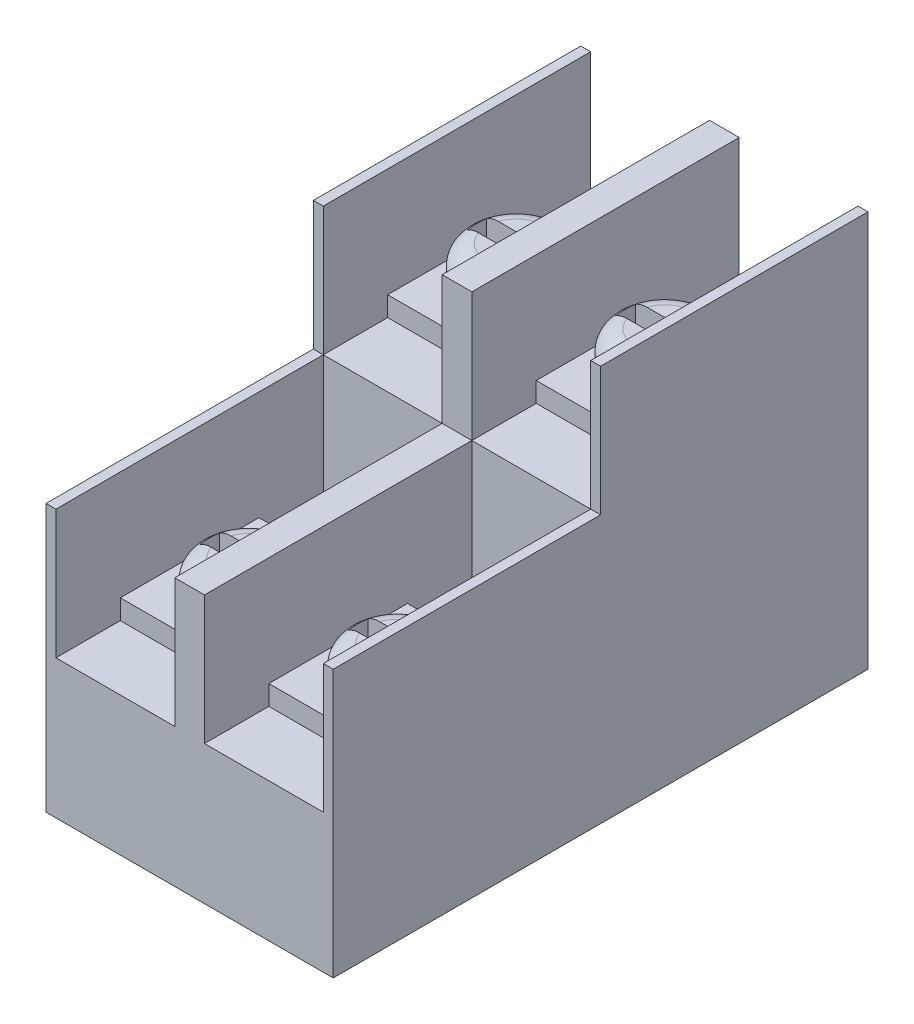
from build123d import *

# Parameters (mm, degrees)
SKETCH_2_W           = 14.5
SKETCH_2_H           = 27
EXTRUDE_1_DEPTH      = 20
SKETCH_3_W           = 13.5
SKETCH_3_H           = 6.5
CUT_EXTRUDE_1_DEPTH  = 29.151376521
SKETCH_5_W           = 6
SKETCH_5_H           = 13.5
CUT_EXTRUDE_2_DEPTH  = 6.5
SKETCH_7_W           = 6
SKETCH_7_H           = 13.5
CUT_EXTRUDE_4_DEPTH  = 6.5
SKETCH_8_W           = 6
SKETCH_8_H           = 7
SKETCH_8_R           = 1.75
EXTRUDE_3_DEPTH      = 1
SKETCH_9_W           = 6
SKETCH_9_H           = 7
SKETCH_9_R           = 1.75
EXTRUDE_4_DEPTH      = 1
SKETCH_10_R          = 2.5
EXTRUDE_5_DEPTH      = 2
SKETCH_14_R          = 2.5
EXTRUDE_6_DEPTH      = 1.5
FILLET_1_R           = 1
CUT_EXTRUDE_START    = -1.2
CUT_EXTRUDE_12_DEPTH = 1.2
CUT_EXTRUDE_13_DEPTH = 1.2
SKETCH_17_R          = 0.5
EXTRUDE_7_DEPTH      = 3


with BuildPart() as part:
    # 草图2 → 凸台-拉伸1 (new body)
    with BuildSketch(Plane(origin=(0, 0, 0), x_dir=(1, 0, 0), z_dir=(0, 1, 0))):
        Rectangle(SKETCH_2_W, SKETCH_2_H)
    extrude(amount=EXTRUDE_1_DEPTH)

    # 草图3 → 切除-拉伸1 (cut, through all)
    with BuildSketch(Plane(origin=(7.25, 0, 0), x_dir=(0, 0, -1), z_dir=(1, 0, 0))):
        with Locations((-6.75, 16.75)):
            Rectangle(SKETCH_3_W, SKETCH_3_H)
    extrude(amount=-CUT_EXTRUDE_1_DEPTH, mode=Mode.SUBTRACT)

    # 草图5 → 切除-拉伸2 (cut)
    with BuildSketch(Plane(origin=(0, 20, 0), x_dir=(1, 0, 0), z_dir=(0, 1, 0))):
        with Locations((3.75, 6.75)):
            Rectangle(SKETCH_5_W, SKETCH_5_H)
        with Locations((-3.75, 6.75)):
            Rectangle(SKETCH_5_W, SKETCH_5_H)
    extrude(amount=-CUT_EXTRUDE_2_DEPTH, mode=Mode.SUBTRACT)

    # 草图7 → 切除-拉伸4 (cut)
    with BuildSketch(Plane(origin=(0, 13.5, 0), x_dir=(1, 0, 0), z_dir=(0, 1, 0))):
        with Locations((3.75, -6.75)):
            Rectangle(SKETCH_7_W, SKETCH_7_H)
        with Locations((-3.75, -6.75)):
            Rectangle(SKETCH_7_W, SKETCH_7_H)
    extrude(amount=-CUT_EXTRUDE_4_DEPTH, mode=Mode.SUBTRACT)

    # 草图8 → 凸台-拉伸3 (add)
    # profile 1 of 2: a face of its own
    with BuildSketch(Plane(origin=(0, 13.5, 0), x_dir=(1, 0, 0), z_dir=(0, 1, 0))):
        with Locations((-3.75, 6.75)):
            Rectangle(SKETCH_8_W, SKETCH_8_H)
        with Locations((-3.75, 6.75)):
            Circle(SKETCH_8_R, mode=Mode.SUBTRACT)
    # profile 2 of 2: a face of its own
    with BuildSketch(Plane(origin=(0, 13.5, 0), x_dir=(1, 0, 0), z_dir=(0, 1, 0))):
        with Locations((3.75, 6.75)):
            Rectangle(SKETCH_8_W, SKETCH_8_H)
        with Locations((3.75, 6.75)):
            Circle(SKETCH_8_R, mode=Mode.SUBTRACT)
    extrude(amount=EXTRUDE_3_DEPTH)

    # 草图9 → 凸台-拉伸4 (add)
    # profile 1 of 2: a face of its own
    with BuildSketch(Plane(origin=(0, 7, 0), x_dir=(1, 0, 0), z_dir=(0, 1, 0))):
        with Locations((-3.75, -6.75)):
            Rectangle(SKETCH_9_W, SKETCH_9_H)
        with Locations((-3.75, -6.75)):
            Circle(SKETCH_9_R, mode=Mode.SUBTRACT)
    # profile 2 of 2: a face of its own
    with BuildSketch(Plane(origin=(0, 7, 0), x_dir=(1, 0, 0), z_dir=(0, 1, 0))):
        with Locations((3.75, -6.75)):
            Rectangle(SKETCH_9_W, SKETCH_9_H)
        with Locations((3.75, -6.75)):
            Circle(SKETCH_9_R, mode=Mode.SUBTRACT)
    extrude(amount=EXTRUDE_4_DEPTH)

    # 草图10 → 凸台-拉伸5 (add)
    with BuildSketch(Plane(origin=(0, 14.5, 0), x_dir=(1, 0, 0), z_dir=(0, 1, 0))):
        with Locations((3.75, 6.75)):
            Circle(SKETCH_10_R)
        with Locations((-3.75, 6.75)):
            Circle(SKETCH_10_R)
    extrude(amount=EXTRUDE_5_DEPTH)

    # 草图14 → 凸台-拉伸6 (add)
    with BuildSketch(Plane(origin=(0, 8, 0), x_dir=(1, 0, 0), z_dir=(0, 1, 0))):
        with Locations((-3.75, -6.75)):
            Circle(SKETCH_14_R)
        with Locations((3.75, -6.75)):
            Circle(SKETCH_14_R)
    extrude(amount=EXTRUDE_6_DEPTH)

    # 圆角1
    fillet_1_edges = [part.edges().sort_by_distance(p)[0] for p in [
        (-6.25, 16.5, -6.75),
        (1.25, 16.5, -6.75),
        (1.25, 9.5, 6.75),
        (-6.25, 9.5, 6.75),
    ]]
    fillet(fillet_1_edges, radius=FILLET_1_R)

    # 草图15 → 切除-拉伸12 (cut)
    with BuildSketch(Plane(origin=(0, 9.5, 0), x_dir=(1, 0, 0), z_dir=(0, 1, 0)).offset(CUT_EXTRUDE_START)):
        with BuildLine():
            Line((3.25, -9.199489743), (3.25, -7.25))
            Line((3.25, -7.25), (1.75, -7.25))
            Line((1.75, -7.25), (1.75, -6.25))
            Line((1.75, -6.25), (3.25, -6.25))
            Line((3.25, -6.25), (3.25, -4.300510257))
            ThreePointArc((3.25, -4.300510257), (3.75, -4.25), (4.25, -4.300510257))
            Line((4.25, -4.300510257), (4.25, -6.25))
            Line((4.25, -6.25), (5.75, -6.25))
            Line((5.75, -6.25), (5.75, -7.25))
            Line((5.75, -7.25), (4.25, -7.25))
            Line((4.25, -7.25), (4.25, -9.199489743))
            ThreePointArc((4.25, -9.199489743), (3.75, -9.25), (3.25, -9.199489743))
        make_face()
        with BuildLine():
            Line((-4.25, -6.25), (-5.75, -6.25))
            Line((-5.75, -6.25), (-5.75, -7.25))
            Line((-5.75, -7.25), (-4.25, -7.25))
            Line((-4.25, -7.25), (-4.25, -9.199489743))
            ThreePointArc((-4.25, -9.199489743), (-3.75, -9.25), (-3.25, -9.199489743))
            Line((-3.25, -9.199489743), (-3.25, -7.25))
            Line((-3.25, -7.25), (-1.75, -7.25))
            Line((-1.75, -7.25), (-1.75, -6.25))
            Line((-1.75, -6.25), (-3.25, -6.25))
            Line((-3.25, -6.25), (-3.25, -4.300510257))
            ThreePointArc((-3.25, -4.300510257), (-3.75, -4.25), (-4.25, -4.300510257))
            Line((-4.25, -4.300510257), (-4.25, -6.25))
        make_face()
    extrude(amount=CUT_EXTRUDE_12_DEPTH, mode=Mode.SUBTRACT)

    # 草图16 → 切除-拉伸13 (cut)
    with BuildSketch(Plane(origin=(0, 16.5, 0), x_dir=(1, 0, 0), z_dir=(0, 1, 0)).offset(CUT_EXTRUDE_START)):
        with BuildLine():
            Line((-3.25, 7.25), (-1.75, 7.25))
            Line((-1.75, 7.25), (-1.75, 6.25))
            Line((-1.75, 6.25), (-3.25, 6.25))
            Line((-3.25, 6.25), (-3.25, 4.280241369))
            ThreePointArc((-3.25, 4.280241369), (-3.75, 4.230137366), (-4.25, 4.280241369))
            Line((-4.25, 4.280241369), (-4.25, 6.25))
            Line((-4.25, 6.25), (-5.75, 6.25))
            Line((-5.75, 6.25), (-5.75, 7.25))
            Line((-5.75, 7.25), (-4.25, 7.25))
            Line((-4.25, 7.25), (-4.25, 9.199489743))
            ThreePointArc((-4.25, 9.199489743), (-3.75, 9.25), (-3.25, 9.199489743))
            Line((-3.25, 9.199489743), (-3.25, 7.25))
        make_face()
        with BuildLine():
            Line((1.75, 7.25), (1.75, 6.25))
            Line((1.75, 6.25), (3.25, 6.25))
            Line((3.25, 6.25), (3.25, 4.280241369))
            ThreePointArc((3.25, 4.280241369), (3.75, 4.230137366), (4.25, 4.280241369))
            Line((4.25, 4.280241369), (4.25, 6.25))
            Line((4.25, 6.25), (5.75, 6.25))
            Line((5.75, 6.25), (5.75, 7.25))
            Line((5.75, 7.25), (4.25, 7.25))
            Line((4.25, 7.25), (4.25, 9.199489743))
            ThreePointArc((4.25, 9.199489743), (3.75, 9.25), (3.25, 9.199489743))
            Line((3.25, 9.199489743), (3.25, 7.25))
            Line((3.25, 7.25), (1.75, 7.25))
        make_face()
    extrude(amount=CUT_EXTRUDE_13_DEPTH, mode=Mode.SUBTRACT)

    # 草图17 → 凸台-拉伸7 (add)
    with BuildSketch(Plane.XZ):
        with Locations((3.75, 6.75)):
            Circle(SKETCH_17_R)
        with Locations((-3.75, 6.75)):
            Circle(SKETCH_17_R)
        with Locations((-3.75, -6.75)):
            Circle(SKETCH_17_R)
        with Locations((3.75, -6.75)):
            Circle(SKETCH_17_R)
    extrude(amount=EXTRUDE_7_DEPTH)


solid = part.part
